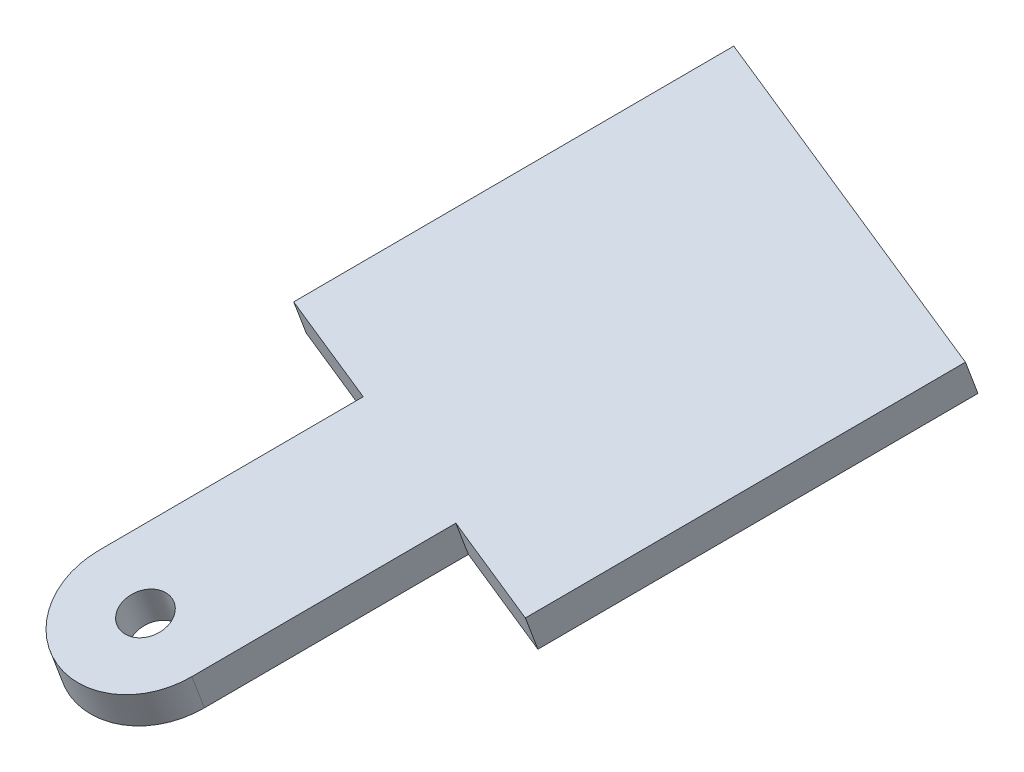
from build123d import *

# Parameters (mm, degrees)
BOSS_EXTRUDE1_DEPTH = 5
SKETCH4_R           = 3
CUT_EXTRUDE1_DEPTH  = 10


with BuildPart() as part:
    # Sketch2 → Boss-Extrude1 (new body)
    with BuildSketch(Plane(origin=(-485.015646161, 24.093142413, 406.723630023), x_dir=(-0.33134858273877504, -0.33551808976833275, 0.8818365654446487), z_dir=(0.01278928757011018, 0.9329525633784883, 0.35977207869560524))):
        with BuildLine():
            Line((-234.138639033, 163.849094652), (-264.138639033, 163.849094652))
            Line((-264.138639033, 163.849094652), (-264.138639033, 148.849094652))
            Line((-264.138639033, 148.849094652), (-314.138639033, 148.849094652))
            Line((-314.138639033, 148.849094652), (-314.138639033, 198.849094652))
            Line((-314.138639033, 198.849094652), (-264.138639033, 198.849094652))
            Line((-264.138639033, 198.849094652), (-264.138639033, 183.849094652))
            Line((-264.138639033, 183.849094652), (-234.138639033, 183.849094652))
            ThreePointArc((-234.138639033, 183.849094652), (-224.138639033, 173.849094652), (-234.138639033, 163.849094652))
        make_face()
    extrude(amount=BOSS_EXTRUDE1_DEPTH)

    # Sketch4 → Cut-Extrude1 (cut)
    with BuildSketch(Plane(origin=(2.14351734, 156.365238193, 60.298721488), x_dir=(0.9998797108139565, -0.008774851910303088, -0.01278928757011018), z_dir=(0.012789287570110183, 0.9329525633784884, 0.3597720786956052))):
        with Locations((-247.332395055, -205.353382383)):
            Circle(SKETCH4_R)
    extrude(amount=-CUT_EXTRUDE1_DEPTH, mode=Mode.SUBTRACT)


solid = part.part
